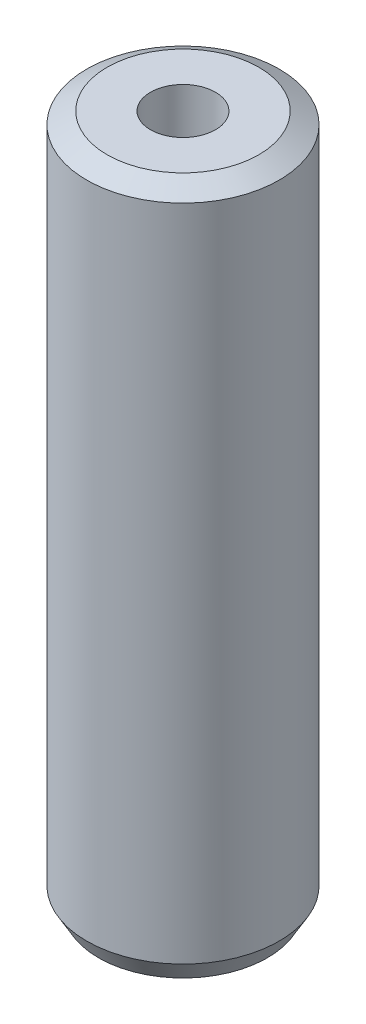
from build123d import *
from OCP.BRepFilletAPI import BRepFilletAPI_MakeChamfer

# Parameters (mm, degrees)
SKETCH1_R           = 47.5
BOSS_EXTRUDE1_DEPTH = 341.145152006
SKETCH2_R           = 16.052964259
CUT_EXTRUDE1_DEPTH  = 348.69600909
CHAMFER1_SIZE       = 5.80738996
CHAMFER1_SIZE2      = 10.05869447


with BuildPart() as part:
    # Sketch1 → Boss-Extrude1 (new body)
    with BuildSketch(Plane(origin=(0, 0, 0), x_dir=(1, 0, 0), z_dir=(0, 1, 0))):
        Circle(SKETCH1_R)
    extrude(amount=BOSS_EXTRUDE1_DEPTH)

    # Sketch2 → Cut-Extrude1 (cut, through all)
    with BuildSketch(Plane(origin=(0, 0, 0), x_dir=(1, 0, 0), z_dir=(0, 1, 0))):
        Circle(SKETCH2_R)
    extrude(amount=CUT_EXTRUDE1_DEPTH, mode=Mode.SUBTRACT)

    # Chamfer1: one chamfer whose edges measure the first distance from different faces: ONE call of the kernel's chamfer builder (chamfer() names one face for all edges)
    chamfer1_edges_1 = [part.edges().sort_by_distance(p)[0] for p in [
        (-47.5, 341.145152006, 0),
    ]]
    chamfer1_side_1 = [part.faces().sort_by_distance(p)[0] for p in [
        (-47.5, 170.572576003, 0),
    ]]
    chamfer1_edges_2 = [part.edges().sort_by_distance(p)[0] for p in [
        (-47.5, 0, 0),
    ]]
    chamfer1_side_2 = [part.faces().sort_by_distance(p)[0] for p in [
        (-46.156497116, 0, 0),
    ]]
    chamfer1 = BRepFilletAPI_MakeChamfer(part.part.solid().wrapped)
    for e in chamfer1_edges_1:
        chamfer1.Add(CHAMFER1_SIZE, CHAMFER1_SIZE2, e.wrapped, chamfer1_side_1[0].wrapped)  # the first distance lies on this face
    for e in chamfer1_edges_2:
        chamfer1.Add(CHAMFER1_SIZE, CHAMFER1_SIZE2, e.wrapped, chamfer1_side_2[0].wrapped)  # the first distance lies on this face
    add(Compound.cast(chamfer1.Shape()), mode=Mode.REPLACE)


solid = part.part
